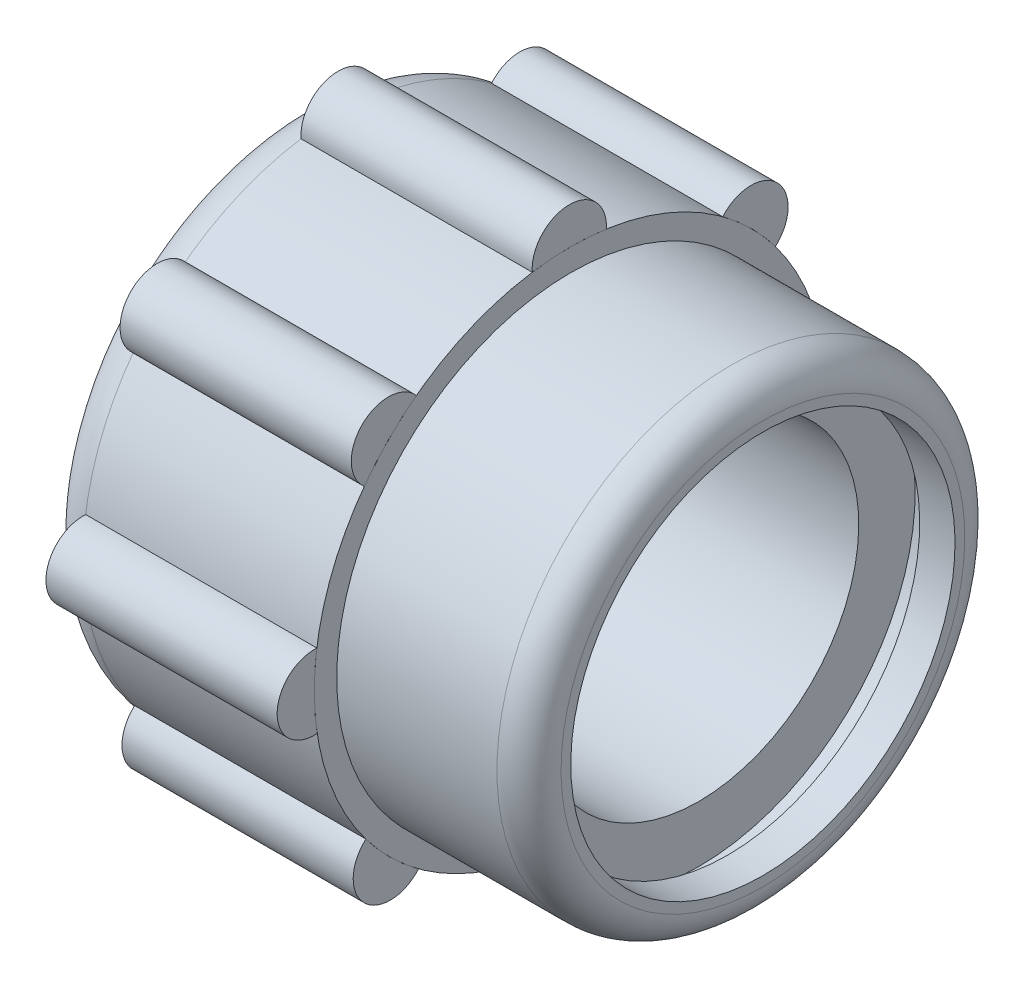
from build123d import *

# Parameters (mm, degrees)
FILLET_3_R               = 1.3
FILLET_4_R               = 1
EXTRUDE_5_DEPTH          = 7.215220421
PATTERN_CIRCULAR_2_COUNT = 8


with BuildPart() as part:
    # Эскиз2 → Повернуть1 (revolve)
    with BuildSketch(Plane.XY, mode=Mode.PRIVATE) as revolve_1_sk:
        Polygon((0, 8), (0, 6.898346752), (0.7, 6.898346752), (0.7, 4.990991269), (12.5, 4.990991269), (12.5, 6.750991269), (13.39735467, 6.750991269), (13.39735467, 5.995695632), (14.5, 5.995695632), (14.5, 6.265355114), (14.5, 7.3), (8.5, 7.3), (8.5, 8), align=None)
    revolve(revolve_1_sk.sketch.rotate(Axis((0, 0, 0), (1, 0, 0)), 180), axis=Axis((0, 0, 0), (1, 0, 0)))

    # Скругление3
    # the kernel refuses this fillet: 1.3 mm, written as the material it takes off along each edge
    with BuildSketch(Plane(origin=(0, 0, 0), x_dir=(0, -1, 0), z_dir=(0, 0, 1))) as fillet_3_piece_1:
        with BuildLine():
            CenterArc((6.7, 1.284779579), FILLET_3_R, 278.77614781, 81.22385219)
            Line((8, 1.284779579), (8.026, 1.284779579))
            Line((8.026, 1.284779579), (8.026, 0))
            Line((8.026, 0), (8, -0.026))
            ThreePointArc((8, -0.026), (7.449173376, -0.026), (6.902313687, -0.025695592))
            Line((6.902313687, -0.025695592), (6.898346752, 0))
        make_face()
    revolve(axis=Axis((0, 0, 0), (1, 0, 0)), mode=Mode.SUBTRACT)

    # Скругление4
    fillet_4_edges = [part.edges().sort_by_distance(p)[0] for p in [
        (14.5, 7.3, 0),
    ]]
    fillet(fillet_4_edges, radius=FILLET_4_R)


with BuildPart() as body_2:
    # Эскиз5 → Бобышка-Вытянуть5 (new body)
    with BuildSketch(Plane(origin=(1.284779579, 0, 0), x_dir=(0, 0, -1), z_dir=(1, 0, 0))):
        with BuildLine():
            ThreePointArc((7.914111034, -1.114031771), (9.158845977, 0.043851987), (7.909911549, 1.197204782))
            add(Edge.make_bspline(
                [(7.914111034, -1.114031771), (8.035384164, -0.393042361), (8.022984515, 0.476641176), (7.909911549, 1.197204782)],
                knots=[0, 0, 0, 0, 0.218343564, 0.218343564, 0.218343564, 0.218343564], degree=3))
        make_face()
    extrude(amount=EXTRUDE_5_DEPTH)


with BuildPart() as pattern_circular_2_1:
    # Круговой массив2: pattern copy
    add(body_2.part.rotate(Axis((1.284779579, 0, 0), (-1, 0, 0)), 1 * 360 / PATTERN_CIRCULAR_2_COUNT))


with BuildPart() as pattern_circular_2_2:
    # Круговой массив2: pattern copy
    add(body_2.part.rotate(Axis((1.284779579, 0, 0), (-1, 0, 0)), 2 * 360 / PATTERN_CIRCULAR_2_COUNT))


with BuildPart() as pattern_circular_2_3:
    # Круговой массив2: pattern copy
    add(body_2.part.rotate(Axis((1.284779579, 0, 0), (-1, 0, 0)), 3 * 360 / PATTERN_CIRCULAR_2_COUNT))


with BuildPart() as pattern_circular_2_4:
    # Круговой массив2: pattern copy
    add(body_2.part.rotate(Axis((1.284779579, 0, 0), (-1, 0, 0)), 4 * 360 / PATTERN_CIRCULAR_2_COUNT))


with BuildPart() as pattern_circular_2_5:
    # Круговой массив2: pattern copy
    add(body_2.part.rotate(Axis((1.284779579, 0, 0), (-1, 0, 0)), 5 * 360 / PATTERN_CIRCULAR_2_COUNT))


with BuildPart() as pattern_circular_2_6:
    # Круговой массив2: pattern copy
    add(body_2.part.rotate(Axis((1.284779579, 0, 0), (-1, 0, 0)), 6 * 360 / PATTERN_CIRCULAR_2_COUNT))


with BuildPart() as pattern_circular_2_7:
    # Круговой массив2: pattern copy
    add(body_2.part.rotate(Axis((1.284779579, 0, 0), (-1, 0, 0)), 7 * 360 / PATTERN_CIRCULAR_2_COUNT))


solid = Compound([part.part, body_2.part, pattern_circular_2_1.part, pattern_circular_2_2.part, pattern_circular_2_3.part, pattern_circular_2_4.part, pattern_circular_2_5.part, pattern_circular_2_6.part, pattern_circular_2_7.part])
